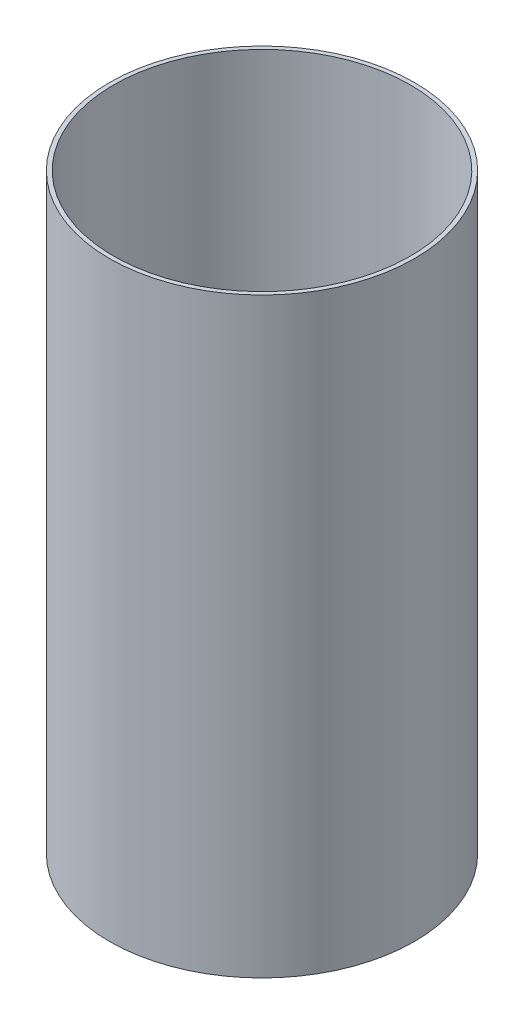
from build123d import *

# Parameters (mm, degrees)
SKETCH1_R           = 78.5876
SKETCH1_R_2         = 76.454
BOSS_EXTRUDE1_DEPTH = 304.8


with BuildPart() as part:
    # Sketch1 → Boss-Extrude1 (new body)
    with BuildSketch(Plane(origin=(0, 0, 0), x_dir=(1, 0, 0), z_dir=(0, 1, 0))):
        Circle(SKETCH1_R)
        Circle(SKETCH1_R_2, mode=Mode.SUBTRACT)
    extrude(amount=BOSS_EXTRUDE1_DEPTH)


solid = part.part
